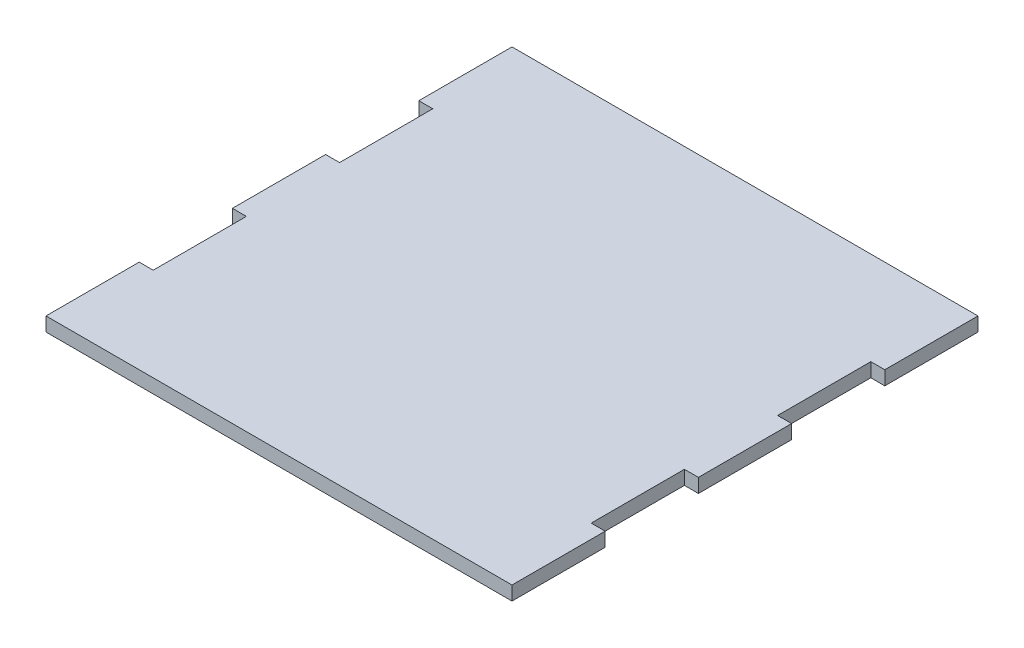
from build123d import *

# Parameters (mm, degrees)
SKETCH1_W           = 200
SKETCH1_H           = 200
BOSS_EXTRUDE1_DEPTH = 6
SKETCH2_W           = 6
SKETCH2_H           = 40
CUT_EXTRUDE1_DEPTH  = 6


with BuildPart() as part:
    # Sketch1 → Boss-Extrude1 (new body)
    with BuildSketch(Plane(origin=(0, 0, 0), x_dir=(1, 0, 0), z_dir=(0, 1, 0))):
        Rectangle(SKETCH1_W, SKETCH1_H)
    extrude(amount=BOSS_EXTRUDE1_DEPTH)

    # Sketch2 → Cut-Extrude1 (cut)
    with BuildSketch(Plane(origin=(0, 6, 0), x_dir=(1, 0, 0), z_dir=(0, 1, 0))):
        with Locations((-97, 40)):
            Rectangle(SKETCH2_W, SKETCH2_H)
        with Locations((97, 40)):
            Rectangle(SKETCH2_W, SKETCH2_H)
        with Locations((97, -40)):
            Rectangle(SKETCH2_W, SKETCH2_H)
        with Locations((-97, -40)):
            Rectangle(SKETCH2_W, SKETCH2_H)
    extrude(amount=-CUT_EXTRUDE1_DEPTH, mode=Mode.SUBTRACT)


solid = part.part
